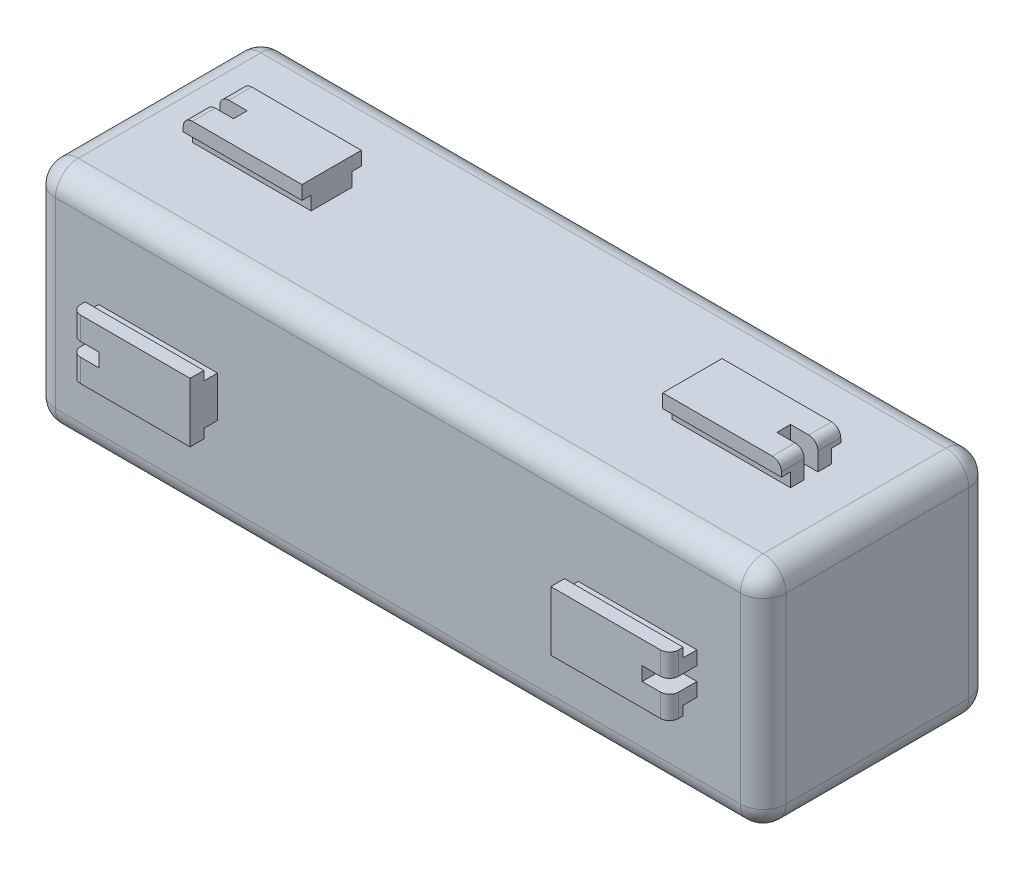
from build123d import *

# Parameters (mm, degrees)
SKETCH1_W               = 160
SKETCH1_H               = 50
BOSS_EXTRUDE1_DEPTH     = 25
SKETCH2_W               = 26
SKETCH2_H               = 13
CONNECTOR_BASE_DEPTH    = 6
SKETCH3_W               = 2
SKETCH3_H               = 3
DOVETAIL_CUT_DEPTH      = 151.851748415
FILLET1_R               = 2
SKETCH4_W               = 3
SKETCH4_H               = 6
CUT_EXTRUDE1_DEPTH      = 6
CIRPATTERN1_START       = -4.5
CIRPATTERN1_OUTLINE_W   = 20
CIRPATTERN1_OUTLINE_H   = 6
CIRPATTERN1_DEPTH       = 9
CIRPATTERN1_START_2     = -6.5
CIRPATTERN1_2_OUTLINE_W = 20
CIRPATTERN1_2_OUTLINE_H = 3
CIRPATTERN1_2_DEPTH     = 13
CIRPATTERN1_3_DEPTH     = 3
CIRPATTERN1_START_3     = 1.5
CIRPATTERN1_4_DEPTH     = 3
CIRPATTERN1_5_DEPTH     = 2
CIRPATTERN1_START_4     = 4.5
CIRPATTERN1_6_DEPTH     = 2
CIRPATTERN1_7_OUTLINE_W = 20
CIRPATTERN1_7_OUTLINE_H = 6
CIRPATTERN1_7_DEPTH     = 9
CIRPATTERN1_8_OUTLINE_W = 20
CIRPATTERN1_8_OUTLINE_H = 3
CIRPATTERN1_8_DEPTH     = 13
CIRPATTERN1_9_DEPTH     = 3
CIRPATTERN1_10_DEPTH    = 3
CIRPATTERN1_11_DEPTH    = 2
CIRPATTERN1_12_DEPTH    = 2
MIRROR1_START           = -4.5
MIRROR1_OUTLINE_W       = 20
MIRROR1_OUTLINE_H       = 6
MIRROR1_DEPTH           = 9
MIRROR1_START_2         = -6.5
MIRROR1_2_OUTLINE_W     = 20
MIRROR1_2_OUTLINE_H     = 3
MIRROR1_2_DEPTH         = 13
MIRROR1_3_DEPTH         = 3
MIRROR1_START_3         = 1.5
MIRROR1_4_DEPTH         = 3
MIRROR1_5_DEPTH         = 2
MIRROR1_START_4         = 4.5
MIRROR1_6_DEPTH         = 2
MIRROR1_7_OUTLINE_W     = 20
MIRROR1_7_OUTLINE_H     = 6
MIRROR1_7_DEPTH         = 9
MIRROR1_8_OUTLINE_W     = 20
MIRROR1_8_OUTLINE_H     = 3
MIRROR1_8_DEPTH         = 13
MIRROR1_9_DEPTH         = 3
MIRROR1_10_DEPTH        = 3
MIRROR1_11_DEPTH        = 2
MIRROR1_12_DEPTH        = 2
FILLET2_R               = 5
SKETCH5_W               = 150
SKETCH5_H               = 40
CUT_EXTRUDE2_DEPTH      = 6


# Read off the part's stored shape, not the designer's step: CirPattern1, Mirror1
with BuildPart() as part:
    # Sketch1 → Boss-Extrude1 (new, symmetric)
    with BuildSketch(Plane(origin=(0, 0, 0), x_dir=(1, 0, 0), z_dir=(0, 1, 0))):
        Rectangle(SKETCH1_W, SKETCH1_H)
    extrude(amount=BOSS_EXTRUDE1_DEPTH, both=True)

    # Sketch2 → connector base (add)
    with BuildSketch(Plane(origin=(0, 25, 0), x_dir=(1, 0, 0), z_dir=(0, 1, 0))):
        with Locations((-52.5, 0)):
            Rectangle(SKETCH2_W, SKETCH2_H)
    extrude(amount=CONNECTOR_BASE_DEPTH)

    # Sketch3 → dovetail cut (cut, through all)
    with BuildSketch(Plane.ZY.offset(65.5)):
        with Locations((5.5, 26.5)):
            Rectangle(SKETCH3_W, SKETCH3_H)
        with Locations((-5.5, 26.5)):
            Rectangle(SKETCH3_W, SKETCH3_H)
    extrude(amount=-DOVETAIL_CUT_DEPTH, mode=Mode.SUBTRACT)

    # Fillet1
    fillet1_edges = [part.edges().sort_by_distance(p)[0] for p in [
        (-65.5, 31, 0),
    ]]
    fillet(fillet1_edges, radius=FILLET1_R)

    # Sketch4 → Cut-Extrude1 (cut)
    with BuildSketch(Plane.ZY.offset(65.5)):
        with Locations((0, 28)):
            Rectangle(SKETCH4_W, SKETCH4_H)
    extrude(amount=-CUT_EXTRUDE1_DEPTH, mode=Mode.SUBTRACT)

    # CirPattern1 outline → CirPattern1 (add)
    with BuildSketch(Plane(origin=(0, 0, 0), x_dir=(1, 0, 0), z_dir=(0, 1, 0)).offset(CIRPATTERN1_START)):
        with Locations((-49.5, 28)):
            Rectangle(CIRPATTERN1_OUTLINE_W, CIRPATTERN1_OUTLINE_H)
        with Locations((-49.5, -28)):
            Rectangle(CIRPATTERN1_OUTLINE_W, CIRPATTERN1_OUTLINE_H)
    extrude(amount=CIRPATTERN1_DEPTH)

    # CirPattern1 2 outline → CirPattern1 2 (add)
    with BuildSketch(Plane(origin=(0, 0, 0), x_dir=(1, 0, 0), z_dir=(0, 1, 0)).offset(CIRPATTERN1_START_2)):
        with Locations((-49.5, 29.5)):
            Rectangle(CIRPATTERN1_2_OUTLINE_W, CIRPATTERN1_2_OUTLINE_H)
        with Locations((-49.5, -29.5)):
            Rectangle(CIRPATTERN1_2_OUTLINE_W, CIRPATTERN1_2_OUTLINE_H)
    extrude(amount=CIRPATTERN1_2_DEPTH)

    # CirPattern1 3 outline → CirPattern1 3 (add)
    with BuildSketch(Plane(origin=(0, 0, 0), x_dir=(1, 0, 0), z_dir=(0, 1, 0)).offset(CIRPATTERN1_START)):
        with BuildLine():
            Line((-65.5, 25), (-59.5, 25))
            Line((-59.5, 25), (-59.5, 31))
            Line((-59.5, 31), (-63.5, 31))
            ThreePointArc((-63.5, 31), (-64.914213562, 30.414213562), (-65.5, 29))
            Line((-65.5, 29), (-65.5, 25))
        make_face()
        with BuildLine():
            ThreePointArc((-65.5, -29), (-64.914213562, -30.414213562), (-63.5, -31))
            Line((-63.5, -31), (-59.5, -31))
            Line((-59.5, -31), (-59.5, -25))
            Line((-59.5, -25), (-65.5, -25))
            Line((-65.5, -25), (-65.5, -29))
        make_face()
    extrude(amount=CIRPATTERN1_3_DEPTH)

    # CirPattern1 4 outline → CirPattern1 4 (add)
    with BuildSketch(Plane(origin=(0, 0, 0), x_dir=(1, 0, 0), z_dir=(0, 1, 0)).offset(CIRPATTERN1_START_3)):
        with BuildLine():
            Line((-65.5, 25), (-59.5, 25))
            Line((-59.5, 25), (-59.5, 31))
            Line((-59.5, 31), (-63.5, 31))
            ThreePointArc((-63.5, 31), (-64.914213562, 30.414213562), (-65.5, 29))
            Line((-65.5, 29), (-65.5, 25))
        make_face()
        with BuildLine():
            ThreePointArc((-65.5, -29), (-64.914213562, -30.414213562), (-63.5, -31))
            Line((-63.5, -31), (-59.5, -31))
            Line((-59.5, -31), (-59.5, -25))
            Line((-59.5, -25), (-65.5, -25))
            Line((-65.5, -25), (-65.5, -29))
        make_face()
    extrude(amount=CIRPATTERN1_4_DEPTH)

    # CirPattern1 5 outline → CirPattern1 5 (add)
    with BuildSketch(Plane(origin=(0, 0, 0), x_dir=(1, 0, 0), z_dir=(0, 1, 0)).offset(CIRPATTERN1_START_2)):
        with BuildLine():
            Line((-65.5, 29), (-65.5, 28))
            Line((-65.5, 28), (-59.5, 28))
            Line((-59.5, 28), (-59.5, 31))
            Line((-59.5, 31), (-63.5, 31))
            ThreePointArc((-63.5, 31), (-64.914213562, 30.414213562), (-65.5, 29))
        make_face()
        with BuildLine():
            Line((-65.5, -28), (-65.5, -29))
            ThreePointArc((-65.5, -29), (-64.914213562, -30.414213562), (-63.5, -31))
            Line((-63.5, -31), (-59.5, -31))
            Line((-59.5, -31), (-59.5, -28))
            Line((-59.5, -28), (-65.5, -28))
        make_face()
    extrude(amount=CIRPATTERN1_5_DEPTH)

    # CirPattern1 6 outline → CirPattern1 6 (add)
    with BuildSketch(Plane(origin=(0, 0, 0), x_dir=(1, 0, 0), z_dir=(0, 1, 0)).offset(CIRPATTERN1_START_4)):
        with BuildLine():
            Line((-65.5, 29), (-65.5, 28))
            Line((-65.5, 28), (-59.5, 28))
            Line((-59.5, 28), (-59.5, 31))
            Line((-59.5, 31), (-63.5, 31))
            ThreePointArc((-63.5, 31), (-64.914213562, 30.414213562), (-65.5, 29))
        make_face()
        with BuildLine():
            Line((-65.5, -28), (-65.5, -29))
            ThreePointArc((-65.5, -29), (-64.914213562, -30.414213562), (-63.5, -31))
            Line((-63.5, -31), (-59.5, -31))
            Line((-59.5, -31), (-59.5, -28))
            Line((-59.5, -28), (-65.5, -28))
        make_face()
    extrude(amount=CIRPATTERN1_6_DEPTH)

    # CirPattern1 7 outline → CirPattern1 7 (add)
    with BuildSketch(Plane.XY.offset(CIRPATTERN1_START)):
        with Locations((-49.5, -28)):
            Rectangle(CIRPATTERN1_7_OUTLINE_W, CIRPATTERN1_7_OUTLINE_H)
    extrude(amount=CIRPATTERN1_7_DEPTH)

    # CirPattern1 8 outline → CirPattern1 8 (add)
    with BuildSketch(Plane.XY.offset(CIRPATTERN1_START_2)):
        with Locations((-49.5, -29.5)):
            Rectangle(CIRPATTERN1_8_OUTLINE_W, CIRPATTERN1_8_OUTLINE_H)
    extrude(amount=CIRPATTERN1_8_DEPTH)

    # CirPattern1 9 outline → CirPattern1 9 (add)
    with BuildSketch(Plane.XY.offset(CIRPATTERN1_START)):
        with BuildLine():
            ThreePointArc((-65.5, -29), (-64.914213562, -30.414213562), (-63.5, -31))
            Line((-63.5, -31), (-59.5, -31))
            Line((-59.5, -31), (-59.5, -25))
            Line((-59.5, -25), (-65.5, -25))
            Line((-65.5, -25), (-65.5, -29))
        make_face()
    extrude(amount=CIRPATTERN1_9_DEPTH)

    # CirPattern1 10 outline → CirPattern1 10 (add)
    with BuildSketch(Plane.XY.offset(CIRPATTERN1_START_3)):
        with BuildLine():
            ThreePointArc((-65.5, -29), (-64.914213562, -30.414213562), (-63.5, -31))
            Line((-63.5, -31), (-59.5, -31))
            Line((-59.5, -31), (-59.5, -25))
            Line((-59.5, -25), (-65.5, -25))
            Line((-65.5, -25), (-65.5, -29))
        make_face()
    extrude(amount=CIRPATTERN1_10_DEPTH)

    # CirPattern1 11 outline → CirPattern1 11 (add)
    with BuildSketch(Plane.XY.offset(CIRPATTERN1_START_2)):
        with BuildLine():
            Line((-65.5, -28), (-65.5, -29))
            ThreePointArc((-65.5, -29), (-64.914213562, -30.414213562), (-63.5, -31))
            Line((-63.5, -31), (-59.5, -31))
            Line((-59.5, -31), (-59.5, -28))
            Line((-59.5, -28), (-65.5, -28))
        make_face()
    extrude(amount=CIRPATTERN1_11_DEPTH)

    # CirPattern1 12 outline → CirPattern1 12 (add)
    with BuildSketch(Plane.XY.offset(CIRPATTERN1_START_4)):
        with BuildLine():
            Line((-65.5, -28), (-65.5, -29))
            ThreePointArc((-65.5, -29), (-64.914213562, -30.414213562), (-63.5, -31))
            Line((-63.5, -31), (-59.5, -31))
            Line((-59.5, -31), (-59.5, -28))
            Line((-59.5, -28), (-65.5, -28))
        make_face()
    extrude(amount=CIRPATTERN1_12_DEPTH)

    # Mirror1 outline → Mirror1 (add)
    with BuildSketch(Plane.XY.offset(MIRROR1_START)):
        with Locations((49.5, 28)):
            Rectangle(MIRROR1_OUTLINE_W, MIRROR1_OUTLINE_H)
        with Locations((49.5, -28)):
            Rectangle(MIRROR1_OUTLINE_W, MIRROR1_OUTLINE_H)
    extrude(amount=MIRROR1_DEPTH)

    # Mirror1 2 outline → Mirror1 2 (add)
    with BuildSketch(Plane.XY.offset(MIRROR1_START_2)):
        with Locations((49.5, 29.5)):
            Rectangle(MIRROR1_2_OUTLINE_W, MIRROR1_2_OUTLINE_H)
        with Locations((49.5, -29.5)):
            Rectangle(MIRROR1_2_OUTLINE_W, MIRROR1_2_OUTLINE_H)
    extrude(amount=MIRROR1_2_DEPTH)

    # Mirror1 3 outline → Mirror1 3 (add)
    with BuildSketch(Plane.XY.offset(MIRROR1_START)):
        with BuildLine():
            Line((59.5, 25), (65.5, 25))
            Line((65.5, 25), (65.5, 29))
            ThreePointArc((65.5, 29), (64.914213562, 30.414213562), (63.5, 31))
            Line((63.5, 31), (59.5, 31))
            Line((59.5, 31), (59.5, 25))
        make_face()
        with BuildLine():
            ThreePointArc((63.5, -31), (64.914213562, -30.414213562), (65.5, -29))
            Line((65.5, -29), (65.5, -25))
            Line((65.5, -25), (59.5, -25))
            Line((59.5, -25), (59.5, -31))
            Line((59.5, -31), (63.5, -31))
        make_face()
    extrude(amount=MIRROR1_3_DEPTH)

    # Mirror1 4 outline → Mirror1 4 (add)
    with BuildSketch(Plane.XY.offset(MIRROR1_START_3)):
        with BuildLine():
            Line((59.5, 25), (65.5, 25))
            Line((65.5, 25), (65.5, 29))
            ThreePointArc((65.5, 29), (64.914213562, 30.414213562), (63.5, 31))
            Line((63.5, 31), (59.5, 31))
            Line((59.5, 31), (59.5, 25))
        make_face()
        with BuildLine():
            ThreePointArc((63.5, -31), (64.914213562, -30.414213562), (65.5, -29))
            Line((65.5, -29), (65.5, -25))
            Line((65.5, -25), (59.5, -25))
            Line((59.5, -25), (59.5, -31))
            Line((59.5, -31), (63.5, -31))
        make_face()
    extrude(amount=MIRROR1_4_DEPTH)

    # Mirror1 5 outline → Mirror1 5 (add)
    with BuildSketch(Plane.XY.offset(MIRROR1_START_2)):
        with BuildLine():
            Line((59.5, 28), (65.5, 28))
            Line((65.5, 28), (65.5, 29))
            ThreePointArc((65.5, 29), (64.914213562, 30.414213562), (63.5, 31))
            Line((63.5, 31), (59.5, 31))
            Line((59.5, 31), (59.5, 28))
        make_face()
        with BuildLine():
            ThreePointArc((63.5, -31), (64.914213562, -30.414213562), (65.5, -29))
            Line((65.5, -29), (65.5, -28))
            Line((65.5, -28), (59.5, -28))
            Line((59.5, -28), (59.5, -31))
            Line((59.5, -31), (63.5, -31))
        make_face()
    extrude(amount=MIRROR1_5_DEPTH)

    # Mirror1 6 outline → Mirror1 6 (add)
    with BuildSketch(Plane.XY.offset(MIRROR1_START_4)):
        with BuildLine():
            Line((59.5, 28), (65.5, 28))
            Line((65.5, 28), (65.5, 29))
            ThreePointArc((65.5, 29), (64.914213562, 30.414213562), (63.5, 31))
            Line((63.5, 31), (59.5, 31))
            Line((59.5, 31), (59.5, 28))
        make_face()
        with BuildLine():
            ThreePointArc((63.5, -31), (64.914213562, -30.414213562), (65.5, -29))
            Line((65.5, -29), (65.5, -28))
            Line((65.5, -28), (59.5, -28))
            Line((59.5, -28), (59.5, -31))
            Line((59.5, -31), (63.5, -31))
        make_face()
    extrude(amount=MIRROR1_6_DEPTH)

    # Mirror1 7 outline → Mirror1 7 (add)
    with BuildSketch(Plane(origin=(0, 0, 0), x_dir=(1, 0, 0), z_dir=(0, 1, 0)).offset(MIRROR1_START)):
        with Locations((49.5, 28)):
            Rectangle(MIRROR1_7_OUTLINE_W, MIRROR1_7_OUTLINE_H)
        with Locations((49.5, -28)):
            Rectangle(MIRROR1_7_OUTLINE_W, MIRROR1_7_OUTLINE_H)
    extrude(amount=MIRROR1_7_DEPTH)

    # Mirror1 8 outline → Mirror1 8 (add)
    with BuildSketch(Plane(origin=(0, 0, 0), x_dir=(1, 0, 0), z_dir=(0, 1, 0)).offset(MIRROR1_START_2)):
        with Locations((49.5, 29.5)):
            Rectangle(MIRROR1_8_OUTLINE_W, MIRROR1_8_OUTLINE_H)
        with Locations((49.5, -29.5)):
            Rectangle(MIRROR1_8_OUTLINE_W, MIRROR1_8_OUTLINE_H)
    extrude(amount=MIRROR1_8_DEPTH)

    # Mirror1 9 outline → Mirror1 9 (add)
    with BuildSketch(Plane(origin=(0, 0, 0), x_dir=(1, 0, 0), z_dir=(0, 1, 0)).offset(MIRROR1_START)):
        with BuildLine():
            Line((59.5, 25), (65.5, 25))
            Line((65.5, 25), (65.5, 29))
            ThreePointArc((65.5, 29), (64.914213562, 30.414213562), (63.5, 31))
            Line((63.5, 31), (59.5, 31))
            Line((59.5, 31), (59.5, 25))
        make_face()
        with BuildLine():
            ThreePointArc((63.5, -31), (64.914213562, -30.414213562), (65.5, -29))
            Line((65.5, -29), (65.5, -25))
            Line((65.5, -25), (59.5, -25))
            Line((59.5, -25), (59.5, -31))
            Line((59.5, -31), (63.5, -31))
        make_face()
    extrude(amount=MIRROR1_9_DEPTH)

    # Mirror1 10 outline → Mirror1 10 (add)
    with BuildSketch(Plane(origin=(0, 0, 0), x_dir=(1, 0, 0), z_dir=(0, 1, 0)).offset(MIRROR1_START_3)):
        with BuildLine():
            Line((59.5, 25), (65.5, 25))
            Line((65.5, 25), (65.5, 29))
            ThreePointArc((65.5, 29), (64.914213562, 30.414213562), (63.5, 31))
            Line((63.5, 31), (59.5, 31))
            Line((59.5, 31), (59.5, 25))
        make_face()
        with BuildLine():
            ThreePointArc((63.5, -31), (64.914213562, -30.414213562), (65.5, -29))
            Line((65.5, -29), (65.5, -25))
            Line((65.5, -25), (59.5, -25))
            Line((59.5, -25), (59.5, -31))
            Line((59.5, -31), (63.5, -31))
        make_face()
    extrude(amount=MIRROR1_10_DEPTH)

    # Mirror1 11 outline → Mirror1 11 (add)
    with BuildSketch(Plane(origin=(0, 0, 0), x_dir=(1, 0, 0), z_dir=(0, 1, 0)).offset(MIRROR1_START_2)):
        with BuildLine():
            Line((59.5, 28), (65.5, 28))
            Line((65.5, 28), (65.5, 29))
            ThreePointArc((65.5, 29), (64.914213562, 30.414213562), (63.5, 31))
            Line((63.5, 31), (59.5, 31))
            Line((59.5, 31), (59.5, 28))
        make_face()
        with BuildLine():
            ThreePointArc((63.5, -31), (64.914213562, -30.414213562), (65.5, -29))
            Line((65.5, -29), (65.5, -28))
            Line((65.5, -28), (59.5, -28))
            Line((59.5, -28), (59.5, -31))
            Line((59.5, -31), (63.5, -31))
        make_face()
    extrude(amount=MIRROR1_11_DEPTH)

    # Mirror1 12 outline → Mirror1 12 (add)
    with BuildSketch(Plane(origin=(0, 0, 0), x_dir=(1, 0, 0), z_dir=(0, 1, 0)).offset(MIRROR1_START_4)):
        with BuildLine():
            Line((59.5, 28), (65.5, 28))
            Line((65.5, 28), (65.5, 29))
            ThreePointArc((65.5, 29), (64.914213562, 30.414213562), (63.5, 31))
            Line((63.5, 31), (59.5, 31))
            Line((59.5, 31), (59.5, 28))
        make_face()
        with BuildLine():
            ThreePointArc((63.5, -31), (64.914213562, -30.414213562), (65.5, -29))
            Line((65.5, -29), (65.5, -28))
            Line((65.5, -28), (59.5, -28))
            Line((59.5, -28), (59.5, -31))
            Line((59.5, -31), (63.5, -31))
        make_face()
    extrude(amount=MIRROR1_12_DEPTH)

    # Fillet2
    fillet2_edges = [part.edges().sort_by_distance(p)[0] for p in [
        (80, 25, 0),
        (0, 25, -25),
        (-80, 25, 0),
        (0, -25, -25),
        (80, -25, 0),
        (0, -25, 25),
        (-80, -25, 0),
        (-80, 0, -25),
        (80, 0, -25),
        (80, 0, 25),
        (-80, 0, 25),
        (0, 25, 25),
    ]]
    fillet(fillet2_edges, radius=FILLET2_R)

    # Sketch5 → Cut-Extrude2 (cut)
    with BuildSketch(Plane(origin=(0, -31, 0), x_dir=(-1, 0, 0), z_dir=(0, -1, 0))):
        Rectangle(SKETCH5_W, SKETCH5_H)
    extrude(amount=-CUT_EXTRUDE2_DEPTH, mode=Mode.SUBTRACT)


with BuildPart() as body_2:
    # Split1: the piece on the far side of the plane
    add(part.part)
    split(bisect_by=Plane.ZX.offset(20), keep=Keep.BOTTOM)


with BuildPart() as part_1:
    add(part.part)

    # Split1
    split(bisect_by=Plane.ZX.offset(20), keep=Keep.TOP)


solid = Compound([body_2.part, part_1.part])
